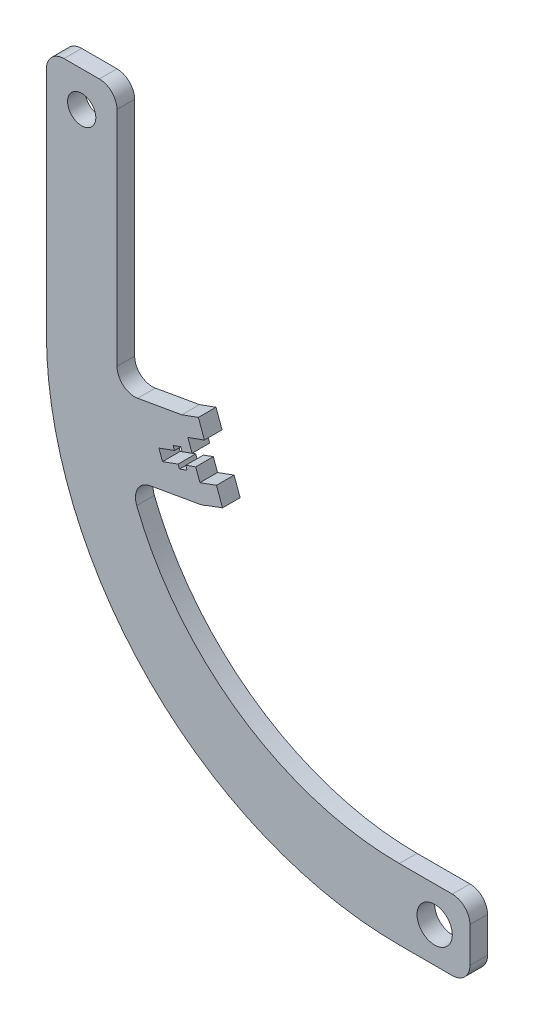
from build123d import *

# Parameters (mm, degrees)
SKETCH1_R           = 5
SKETCH1_R_2         = 4
BOSS_EXTRUDE1_DEPTH = 5
FILLET3_R           = 5


with BuildPart() as part:
    # Sketch1 → Boss-Extrude1 (new body)
    with BuildSketch(Plane.XY):
        with BuildLine():
            Line((-10, 10), (10, 10))
            Line((10, 10), (10, -10))
            Line((10, -10), (-10, -10))
            ThreePointArc((-10, -10), (-80.710678119, 19.289321881), (-110, 90))
            Line((-110, 90), (-110, 160))
            Line((-110, 160), (-90, 160))
            Line((-90, 160), (-90, 90))
            ThreePointArc((-90, 90), (-89.975789808, 88.031994787), (-89.903173887, 86.065180718))
            Line((-89.903173887, 86.065180718), (-71.639655664, 89.285531744))
            Line((-71.639655664, 89.285531744), (-66.94119256, 90.99563246))
            Line((-66.94119256, 90.99563246), (-65.231091843, 86.297169356))
            Line((-65.231091843, 86.297169356), (-69.929554947, 84.58706864))
            Line((-69.929554947, 84.58706864), (-68.732484445, 81.298144467))
            Line((-68.732484445, 81.298144467), (-71.551562308, 80.272084037))
            Line((-71.551562308, 80.272084037), (-71.927784465, 81.30574592))
            Line((-71.927784465, 81.30574592), (-74.089077493, 80.51909959))
            Line((-74.089077493, 80.51909959), (-73.712855336, 79.485437707))
            Line((-73.712855336, 79.485437707), (-78.129410653, 77.877943034))
            Line((-78.129410653, 77.877943034), (-77.103350223, 75.058865171))
            Line((-77.103350223, 75.058865171), (-72.686794906, 76.666359845))
            Line((-72.686794906, 76.666359845), (-72.310572748, 75.632697962))
            Line((-72.310572748, 75.632697962), (-70.14927972, 76.419344292))
            Line((-70.14927972, 76.419344292), (-70.525501878, 77.453006175))
            Line((-70.525501878, 77.453006175), (-67.706424015, 78.479066605))
            Line((-67.706424015, 78.479066605), (-66.509353514, 75.190142432))
            Line((-66.509353514, 75.190142432), (-61.81089041, 76.900243149))
            Line((-61.81089041, 76.900243149), (-60.100789693, 72.201780045))
            Line((-60.100789693, 72.201780045), (-64.799252797, 70.491679328))
            Line((-64.799252797, 70.491679328), (-64.693728557, 70.201753861))
            Line((-64.693728557, 70.201753861), (-86.430210334, 66.369025658))
            ThreePointArc((-86.430210334, 66.369025658), (-57.484324006, 25.616469702), (-10, 10))
        make_face()
        Circle(SKETCH1_R, mode=Mode.SUBTRACT)
        with Locations((-100, 150)):
            Circle(SKETCH1_R_2, mode=Mode.SUBTRACT)
    extrude(amount=BOSS_EXTRUDE1_DEPTH)

    # Fillet3
    # the kernel refuses this fillet: 5 mm, written as the material it adds along each edge
    with BuildSketch(Plane(origin=(-86.430210334, 66.369025658, 0), x_dir=(0.9848077530122086, 0.17364817766692744, 0), z_dir=(0, 0, 1))) as fillet3_piece_1:
        with BuildLine():
            CenterArc((5.887847048, -5), FILLET3_R, 90, 101.536959033)
            ThreePointArc((0.988867563, -6), (0.437404346, -3.009399093), (0, 0))
            Line((0, 0), (5.887847048, 0))
        make_face()
    extrude(amount=5)
    with BuildSketch(Plane(origin=(-89.903173887, 86.065180718, 0), x_dir=(-0.01629387917599103, 0.9998672459388787, 0), z_dir=(0, 0, 1))) as fillet3_piece_2:
        with BuildLine():
            CenterArc((5.8610144, -4.99933623), FILLET3_R, 89.066388177, 100)
            Line((0.923482309, -5.787230163), (0.4297291, -5.866019556))
            Line((0.4297291, -5.866019556), (-0.493753209, -0.078789393))
            Line((-0.493753209, -0.078789393), (-0.016452277, 0.499729249))
            ThreePointArc((-0.016452277, 0.499729249), (3.944021531, 0.532633412), (5.950630735, 0.499933623))
            Line((5.950630735, 0.499933623), (5.942483796, 0))
        make_face()
    extrude(amount=5)
    # the kernel refuses this fillet: 5 mm, written as the material it takes off along each edge
    with BuildSketch(Plane(origin=(10, -10, -12.5), x_dir=(0, 1, 0), z_dir=(0, 0, 1)), Plane(origin=(10, 10, -12.5), x_dir=(-1, 0, 0), z_dir=(0, 0, 1))) as fillet3_2_piece_1:
        with BuildLine():
            CenterArc((FILLET3_R, FILLET3_R), FILLET3_R, 180, 90)
            Line((0, FILLET3_R), (0, 0))
            Line((0, 0), (FILLET3_R, 0))
        make_face()
    extrude(amount=30, mode=Mode.SUBTRACT)
    with BuildSketch(Plane(origin=(-90, 160, -12.5), x_dir=(0, -1, 0), z_dir=(0, 0, 1)), Plane(origin=(-110, 160, -12.5), x_dir=(1, 0, 0), z_dir=(0, 0, 1))) as fillet3_2_piece_2:
        with BuildLine():
            CenterArc((FILLET3_R, -FILLET3_R), FILLET3_R, 90, 90)
            Line((0, -FILLET3_R), (0, 0))
            Line((0, 0), (FILLET3_R, 0))
        make_face()
    extrude(amount=30, mode=Mode.SUBTRACT)
    with BuildSketch(Plane(origin=(-64.693728557, 70.201753861, -4.425012024), x_dir=(-0.9848077530122087, -0.17364817766692653, 0), z_dir=(0, 0, 1))) as fillet3_2_piece_3:
        with BuildLine():
            CenterArc((1.77000481, -5), FILLET3_R, 90, 20.077186637)
            Line((0.053576061, -0.30384494), (0, 0))
            Line((0, 0), (1.77000481, 0))
        make_face()
    extrude(amount=13.850024049, mode=Mode.SUBTRACT)


solid = part.part
